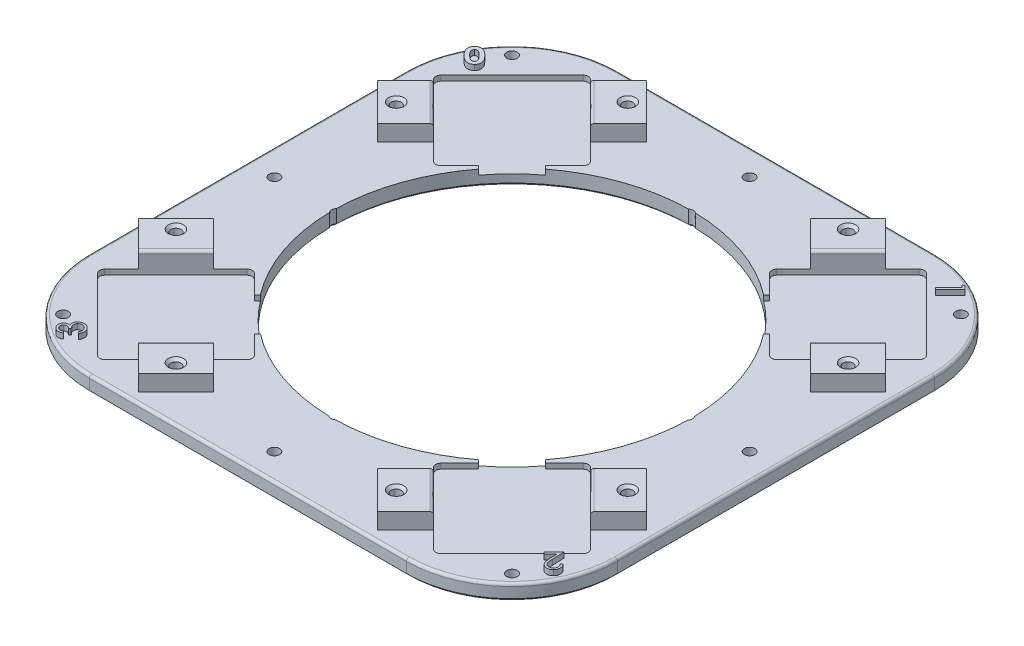
from build123d import *

# Parameters (mm, degrees)
SKETCH_1_W          = 200
SKETCH_1_H          = 200
SKETCH_1_R          = 2
EXTRUDE_1_DEPTH     = 6
CUT_EXTRUDE_1_DEPTH = 2
FILLET_1_R          = 2
EXTRUDE_3_DEPTH     = 6
FILLET_4_R          = 40
SKETCH_4_R          = 1.9
CUT_EXTRUDE_2_DEPTH = 8
SKETCH_7_R          = 12
SKETCH_7_W          = 40
SKETCH_7_H          = 12
SKETCH_7_W_2        = 12
SKETCH_7_H_2        = 40
CUT_EXTRUDE_3_DEPTH = 6
CUT_EXTRUDE_4_DEPTH = 2
FILLET_6_R          = 1
SKETCH_9_R          = 2
CUT_EXTRUDE_5_DEPTH = 10
EXTRUDE_6_DEPTH     = 2
FILLET_9_R          = 1
SKETCH_11_R         = 68
CUT_EXTRUDE_6_DEPTH = 10
CHAMFER_1_SIZE      = 1
CHAMFER_2_SIZE      = 1


with BuildPart() as part:
    # Эскиз1 → Бобышка-Вытянуть1 (new body)
    with BuildSketch(Plane(origin=(0, 0, 0), x_dir=(1, 0, 0), z_dir=(0, 1, 0))):
        Rectangle(SKETCH_1_W, SKETCH_1_H)
        with Locations((-90, 0)):
            Circle(SKETCH_1_R, mode=Mode.SUBTRACT)
        with Locations((0, 90)):
            Circle(SKETCH_1_R, mode=Mode.SUBTRACT)
        with Locations((90, 0)):
            Circle(SKETCH_1_R, mode=Mode.SUBTRACT)
        with Locations((0, -90)):
            Circle(SKETCH_1_R, mode=Mode.SUBTRACT)
        with Locations((-85, 85)):
            Circle(SKETCH_1_R, mode=Mode.SUBTRACT)
        with Locations((85, 85)):
            Circle(SKETCH_1_R, mode=Mode.SUBTRACT)
        with Locations((85, -85)):
            Circle(SKETCH_1_R, mode=Mode.SUBTRACT)
        with Locations((-85, -85)):
            Circle(SKETCH_1_R, mode=Mode.SUBTRACT)
    extrude(amount=EXTRUDE_1_DEPTH)

    # Эскиз2 → Вырез-Вытянуть1 (cut)
    with BuildSketch(Plane(origin=(0, 6, 0), x_dir=(1, 0, 0), z_dir=(0, 1, 0))):
        Polygon((63.639610307, 33.941125497), (33.941125497, 63.639610307), (63.639610307, 93.338095117), (93.338095117, 63.639610307), align=None)
        Polygon((33.941125497, -63.639610307), (63.639610307, -33.941125497), (93.338095117, -63.639610307), (63.639610307, -93.338095117), align=None)
        Polygon((-63.639610307, -33.941125497), (-33.941125497, -63.639610307), (-63.639610307, -93.338095117), (-93.338095117, -63.639610307), align=None)
        Polygon((-33.941125497, 63.639610307), (-63.639610307, 33.941125497), (-93.338095117, 63.639610307), (-63.639610307, 93.338095117), align=None)
    extrude(amount=-CUT_EXTRUDE_1_DEPTH, mode=Mode.SUBTRACT)

    # Скругление1
    fillet_1_edges = [part.edges().sort_by_distance(p)[0] for p in [
        (63.639610307, 5, -33.941125497),
        (33.941125497, 5, -63.639610307),
        (93.338095117, 5, -63.639610307),
        (63.639610307, 5, -93.338095117),
        (-63.639610307, 5, -93.338095117),
        (-63.639610307, 5, -33.941125497),
        (-93.338095117, 5, -63.639610307),
        (-33.941125497, 5, -63.639610307),
        (63.639610307, 5, 93.338095117),
        (93.338095117, 5, 63.639610307),
        (63.639610307, 5, 33.941125497),
        (33.941125497, 5, 63.639610307),
        (-63.639610307, 5, 93.338095117),
        (-33.941125497, 5, 63.639610307),
        (-63.639610307, 5, 33.941125497),
        (-93.338095117, 5, 63.639610307),
    ]]
    fillet(fillet_1_edges, radius=FILLET_1_R)

    # Эскиз3 → Бобышка-Вытянуть3 (add)
    with BuildSketch(Plane(origin=(0, 6, 0), x_dir=(1, 0, 0), z_dir=(0, 1, 0))):
        Polygon((41.71930009, 71.4177849), (55.861435714, 85.559920524), (45.254833996, 96.166522241), (31.112698372, 82.024386618), align=None)
        Polygon((85.559920524, 55.861435714), (96.166522241, 45.254833996), (82.024386618, 31.112698372), (71.4177849, 41.71930009), align=None)
        Polygon((71.4177849, -41.71930009), (85.559920524, -55.861435714), (96.166522241, -45.254833996), (82.024386618, -31.112698372), align=None)
        Polygon((31.112698372, -82.024386618), (45.254833996, -96.166522241), (55.861435714, -85.559920524), (41.71930009, -71.4177849), align=None)
        Polygon((-41.71930009, -71.4177849), (-55.861435714, -85.559920524), (-45.254833996, -96.166522241), (-31.112698372, -82.024386618), align=None)
        Polygon((-85.559920524, -55.861435714), (-96.166522241, -45.254833996), (-82.024386618, -31.112698372), (-71.4177849, -41.71930009), align=None)
        Polygon((-71.4177849, 41.71930009), (-85.559920524, 55.861435714), (-96.166522241, 45.254833996), (-82.024386618, 31.112698372), align=None)
        Polygon((-31.112698372, 82.024386618), (-45.254833996, 96.166522241), (-55.861435714, 85.559920524), (-41.71930009, 71.4177849), align=None)
    extrude(amount=EXTRUDE_3_DEPTH)

    # Скругление4
    fillet_4_edges = [part.edges().sort_by_distance(p)[0] for p in [
        (100, 3, -100),
        (100, 3, 100),
        (-100, 3, 100),
        (-100, 3, -100),
    ]]
    fillet(fillet_4_edges, radius=FILLET_4_R)

    # Эскиз4 → Вырез-Вытянуть2 (cut)
    with BuildSketch(Plane(origin=(0, 12, 0), x_dir=(1, 0, 0), z_dir=(0, 1, 0))):
        with Locations((41.71930009, 85.559920524)):
            Circle(SKETCH_4_R)
        with Locations((85.559920524, 41.71930009)):
            Circle(SKETCH_4_R)
        with Locations((85.559920524, -41.71930009)):
            Circle(SKETCH_4_R)
        with Locations((41.71930009, -85.559920524)):
            Circle(SKETCH_4_R)
        with Locations((-41.71930009, -85.559920524)):
            Circle(SKETCH_4_R)
        with Locations((-85.559920524, -41.71930009)):
            Circle(SKETCH_4_R)
        with Locations((-85.559920524, 41.71930009)):
            Circle(SKETCH_4_R)
        with Locations((-41.71930009, 85.559920524)):
            Circle(SKETCH_4_R)
    extrude(amount=-CUT_EXTRUDE_2_DEPTH, mode=Mode.SUBTRACT)

    # Эскиз7 → Вырез-Вытянуть3 (cut)
    with BuildSketch(Plane(origin=(0, 6, 0), x_dir=(1, 0, 0), z_dir=(0, 1, 0))):
        with Locations((28.284271247, 28.284271247)):
            Circle(SKETCH_7_R)
        with Locations((28.284271247, -28.284271247)):
            Circle(SKETCH_7_R)
        with Locations((-28.284271247, -28.284271247)):
            Circle(SKETCH_7_R)
        with Locations((-28.284271247, 28.284271247)):
            Circle(SKETCH_7_R)
        with Locations((40, 0)):
            Rectangle(SKETCH_7_W, SKETCH_7_H)
        with Locations((0, 40)):
            Rectangle(SKETCH_7_W_2, SKETCH_7_H_2)
        with Locations((0, -40)):
            Rectangle(SKETCH_7_W_2, SKETCH_7_H_2)
        with Locations((-40, 0)):
            Rectangle(SKETCH_7_W, SKETCH_7_H)
    extrude(amount=-CUT_EXTRUDE_3_DEPTH, mode=Mode.SUBTRACT)

    # Эскиз8 → Вырез-Вытянуть4 (cut)
    with BuildSketch(Plane(origin=(0, 6, 0), x_dir=(1, 0, 0), z_dir=(0, 1, 0))):
        Polygon((44.547727215, 31.819805153), (31.819805153, 44.547727215), (53.033008589, 65.76093065), (65.76093065, 53.033008589), align=None)
        Polygon((65.76093065, -53.033008589), (53.033008589, -65.76093065), (31.819805153, -44.547727215), (44.547727215, -31.819805153), align=None)
        Polygon((-44.547727215, -31.819805153), (-31.819805153, -44.547727215), (-53.033008589, -65.76093065), (-65.76093065, -53.033008589), align=None)
        Polygon((-65.76093065, 53.033008589), (-53.033008589, 65.76093065), (-31.819805153, 44.547727215), (-44.547727215, 31.819805153), align=None)
    extrude(amount=-CUT_EXTRUDE_4_DEPTH, mode=Mode.SUBTRACT)

    # Скругление6
    fillet_6_edges = [part.edges().sort_by_distance(p)[0] for p in [
        (78.488852712, 12, -48.790367902),
        (48.790367902, 12, -78.488852712),
        (-78.488852712, 12, 48.790367902),
        (-48.790367902, 12, 78.488852712),
        (48.790367902, 12, 78.488852712),
        (78.488852712, 12, 48.790367902),
        (-78.488852712, 12, -48.790367902),
        (-48.790367902, 12, -78.488852712),
    ]]
    fillet(fillet_6_edges, radius=FILLET_6_R)

    # Эскиз9 → Вырез-Вытянуть5 (cut)
    with BuildSketch(Plane(origin=(0, 6, 0), x_dir=(1, 0, 0), z_dir=(0, 1, 0))):
        with Locations((0.141931936, 66.467885895)):
            Circle(SKETCH_9_R)
        with Locations((-0.141931936, -66.467885895)):
            Circle(SKETCH_9_R)
        with Locations((66.467885895, -0.141931936)):
            Circle(SKETCH_9_R)
        with Locations((-66.467885895, 0.141931936)):
            Circle(SKETCH_9_R)
    extrude(amount=-CUT_EXTRUDE_5_DEPTH, mode=Mode.SUBTRACT)

    # Эскиз10 → Бобышка-Вытянуть6 (add)
    # profile 1 of 4: a face of its own
    with BuildSketch(Plane(origin=(0, 6, 0), x_dir=(1, 0, 0), z_dir=(0, 1, 0))):
        with BuildLine():
            add(Edge.make_bspline(
                [(-93.008725725, 78.748142248), (-92.957598681, 78.797521313), (-92.85676014, 78.894912293), (-92.695816741, 79.025623668), (-92.532835835, 79.143607747), (-92.364444707, 79.244705894), (-92.19338747, 79.333809788), (-92.016821516, 79.405990635), (-91.83577231, 79.461704551), (-91.651864556, 79.505826632), (-91.463065577, 79.533008597), (-91.270612251, 79.544105355), (-91.074440499, 79.539176393), (-90.875174478, 79.51794816), (-90.671949254, 79.481192006), (-90.46586329, 79.425437226), (-90.254902601, 79.357171516), (-90.040488058, 79.269212477), (-89.819864955, 79.163420892), (-89.593527751, 79.033863441), (-89.359570967, 78.882570897), (-89.117138773, 78.709656313), (-88.869800196, 78.51114685), (-88.612296924, 78.293135309), (-88.348308293, 78.050855484), (-88.172747767, 77.8784765), (-88.082443673, 77.789808915)],
                knots=[0, 0, 0, 0, 0.898182766, 1.771497688, 2.618542862, 3.439672004, 4.25211909, 5.054711465, 5.847125212, 6.644844624, 7.443249755, 8.254994895, 9.079117631, 9.921086753, 10.786032602, 11.686927653, 12.618018076, 13.587382576, 14.61431454, 15.709081657, 16.881705886, 18.135395254, 19.471648796, 20.88972771, 22.400151059, 24, 24, 24, 24], degree=3))
            add(Edge.make_bspline(
                [(-88.082443673, 77.789808915), (-87.99267599, 77.698463012), (-87.818629055, 77.521356129), (-87.574075163, 77.254376099), (-87.352755723, 76.995556331), (-87.155322982, 76.743444497), (-86.979453593, 76.499753648), (-86.827635494, 76.263265193), (-86.697172812, 76.035199404), (-86.593983854, 75.812528771), (-86.505762897, 75.597863606), (-86.435650692, 75.388405368), (-86.380204903, 75.184114783), (-86.341999183, 74.984749296), (-86.317124562, 74.790489333), (-86.308824987, 74.600690128), (-86.317259045, 74.415819605), (-86.339029871, 74.235495262), (-86.378224262, 74.059121756), (-86.433011633, 73.88543721), (-86.503667028, 73.713843244), (-86.590455303, 73.544917992), (-86.694786221, 73.379663841), (-86.810937292, 73.213769659), (-86.94605157, 73.051911723), (-87.045954632, 72.949414733), (-87.09686675, 72.89718071)],
                knots=[0, 0, 0, 0, 1.626693129, 3.153929617, 4.597923221, 5.951226613, 7.220381534, 8.41370076, 9.519612414, 10.554665343, 11.5286677, 12.466351198, 13.358440621, 14.215441504, 15.042756246, 15.844148676, 16.625203713, 17.391079629, 18.148401381, 18.916678168, 19.701702082, 20.502864672, 21.325687275, 22.182312009, 23.073678591, 24, 24, 24, 24], degree=3))
            add(Edge.make_bspline(
                [(-87.09686675, 72.89718071), (-87.149001816, 72.84614528), (-87.251598834, 72.745712247), (-87.415449357, 72.611920711), (-87.581095452, 72.493010238), (-87.748111845, 72.387124201), (-87.920307836, 72.299502255), (-88.094627597, 72.225293141), (-88.272021467, 72.16710318), (-88.452198674, 72.125173685), (-88.635693302, 72.099819479), (-88.822639538, 72.088904452), (-89.013082719, 72.090828854), (-89.207091086, 72.1143069), (-89.40536909, 72.145719544), (-89.606567507, 72.199199877), (-89.811492576, 72.264759097), (-90.022238393, 72.344954071), (-90.237893224, 72.447094582), (-90.460693886, 72.571345842), (-90.692551034, 72.717439447), (-90.930254984, 72.890031869), (-91.177219561, 73.084109407), (-91.432290045, 73.301626079), (-91.696875667, 73.541020342), (-91.871055441, 73.713771109), (-91.960648802, 73.802629428)],
                knots=[0, 0, 0, 0, 0.933090558, 1.836236452, 2.703091185, 3.541342316, 4.363641911, 5.172278286, 5.963363672, 6.749235136, 7.536057157, 8.330354457, 9.143829215, 9.968822976, 10.828425831, 11.710347207, 12.629007139, 13.581006501, 14.593064946, 15.679156618, 16.843448976, 18.097249152, 19.435871615, 20.861513249, 22.385647378, 24, 24, 24, 24], degree=3))
            add(Edge.make_bspline(
                [(-91.960648802, 73.802629428), (-92.083808079, 73.927961036), (-92.321358131, 74.169701086), (-92.642974702, 74.539928393), (-92.927306321, 74.894846854), (-93.16830981, 75.240335887), (-93.371354338, 75.572879883), (-93.528165963, 75.896472645), (-93.650478298, 76.206379417), (-93.697573804, 76.414092671), (-93.720264186, 76.514167889)],
                knots=[0, 0, 0, 0, 1.286987725, 2.482346486, 3.591022616, 4.616940247, 5.566609133, 6.441717498, 7.249227199, 8, 8, 8, 8], degree=3))
            add(Edge.make_bspline(
                [(-93.720264186, 76.514167889), (-93.73621609, 76.619695189), (-93.767435565, 76.826222703), (-93.769463604, 77.134773214), (-93.73708647, 77.432890992), (-93.662918531, 77.719164849), (-93.557667587, 77.996586653), (-93.410830123, 78.260518954), (-93.228823871, 78.514820834), (-93.083287813, 78.669100547), (-93.008725725, 78.748142248)],
                knots=[0, 0, 0, 0, 1.045976366, 2.04708071, 3.017702948, 3.979968869, 4.940634868, 5.921098241, 6.93492198, 8, 8, 8, 8], degree=3))
        make_face()
        with BuildLine():
            add(Edge.make_bspline(
                [(-91.968661622, 77.762565325), (-92.010462791, 77.716369621), (-92.09267178, 77.625518043), (-92.185599358, 77.466056849), (-92.247808891, 77.292789759), (-92.277000053, 77.138763868), (-92.281564988, 77.009210942), (-92.272569584, 76.906266824), (-92.255217222, 76.798367336), (-92.225720447, 76.685914195), (-92.185705795, 76.569081549), (-92.133366823, 76.447952044), (-92.070623007, 76.322116087), (-91.998518706, 76.18904091), (-91.910791112, 76.051145738), (-91.80930652, 75.904601817), (-91.691866402, 75.749325648), (-91.559047432, 75.584504399), (-91.409818285, 75.411433598), (-91.243944165, 75.230965793), (-91.065124091, 75.039589219), (-90.938036359, 74.911792703), (-90.872507776, 74.845898658)],
                knots=[0, 0, 0, 0, 1.075604722, 2.115356592, 3.167844591, 4.248203041, 4.812243559, 5.405508209, 6.032984943, 6.700942317, 7.414044194, 8.167617197, 8.981822607, 9.846245724, 10.784711884, 11.80756956, 12.929501316, 14.151980212, 15.469127066, 16.882155306, 18.392386567, 20, 20, 20, 20], degree=3))
            add(Edge.make_bspline(
                [(-90.872507776, 74.845898658), (-90.7864976, 74.761480543), (-90.621676348, 74.599710156), (-90.376186673, 74.375708535), (-90.142591105, 74.181411662), (-89.920993001, 74.01580443), (-89.712979922, 73.876185004), (-89.516195184, 73.766835437), (-89.332031918, 73.684611929), (-89.159202852, 73.630270157), (-88.995766399, 73.602382197), (-88.842298, 73.587529693), (-88.696426487, 73.594737092), (-88.558484062, 73.616713591), (-88.427977695, 73.656297414), (-88.306707853, 73.716054158), (-88.190628178, 73.788553381), (-88.124171611, 73.852114178), (-88.090456494, 73.884360197)],
                knots=[0, 0, 0, 0, 1.768629636, 3.389223978, 4.875842697, 6.225868878, 7.447880289, 8.54973518, 9.52566295, 10.403516369, 11.200100902, 11.95533547, 12.661618695, 13.336984531, 14.001570975, 14.653788248, 15.317032326, 16, 16, 16, 16], degree=3))
            add(Edge.make_bspline(
                [(-88.090456494, 73.884360197), (-88.060170206, 73.917273087), (-88.000655379, 73.981949384), (-87.928154313, 74.090301918), (-87.872339217, 74.205569408), (-87.835909962, 74.32905055), (-87.814669853, 74.458862384), (-87.812602281, 74.595619521), (-87.824773104, 74.739340345), (-87.846722465, 74.835951399), (-87.858084699, 74.885962761)],
                knots=[0, 0, 0, 0, 0.992959701, 1.951240279, 2.885912978, 3.828695135, 4.802734124, 5.800367936, 6.861345669, 8, 8, 8, 8], degree=3))
            add(Edge.make_bspline(
                [(-87.858084699, 74.885962761), (-87.877060945, 74.949998607), (-87.916921532, 75.084509222), (-88.007273396, 75.286598194), (-88.126064612, 75.49901867), (-88.272102307, 75.722527903), (-88.44647396, 75.957027887), (-88.648604001, 76.202021519), (-88.880645166, 76.45665197), (-89.04719527, 76.627386506), (-89.133725725, 76.716090966)],
                knots=[0, 0, 0, 0, 0.710523542, 1.492491535, 2.35044932, 3.300180637, 4.333113065, 5.460466168, 6.680595133, 8, 8, 8, 8], degree=3))
            add(Edge.make_bspline(
                [(-89.133725725, 76.716090966), (-89.222964963, 76.803682764), (-89.394241612, 76.971797487), (-89.648507303, 77.205255058), (-89.891423716, 77.406883944), (-90.117816027, 77.583359819), (-90.333231584, 77.728162558), (-90.534384646, 77.845045557), (-90.723026558, 77.930887678), (-90.898556487, 77.990917344), (-91.063656834, 78.023876163), (-91.218731192, 78.040982929), (-91.365199368, 78.039958248), (-91.503588791, 78.020388828), (-91.63445609, 77.984561165), (-91.755276867, 77.926461343), (-91.869565032, 77.855138121), (-91.935391485, 77.793645199), (-91.968661622, 77.762565325)],
                knots=[0, 0, 0, 0, 1.794997963, 3.44513516, 4.953227072, 6.325945798, 7.563759521, 8.676594079, 9.661550624, 10.534529874, 11.333105772, 12.073249666, 12.771110835, 13.429383314, 14.075074024, 14.709742177, 15.347875331, 16, 16, 16, 16], degree=3))
        make_face(mode=Mode.SUBTRACT)
    # profile 2 of 4: a face of its own
    with BuildSketch(Plane(origin=(0, 6, 0), x_dir=(1, 0, 0), z_dir=(0, 1, 0))):
        Polygon((78.440095754, 93.074368887), (79.541057292, 91.973407348), (73.941698318, 86.374048374), (73.385608575, 86.930138118), (78.436890626, 91.981420169), (77.557082933, 92.861227861), align=None)
    # profile 3 of 4: a face of its own
    with BuildSketch(Plane(origin=(0, 6, 0), x_dir=(1, 0, 0), z_dir=(0, 1, 0))):
        with BuildLine():
            Line((92.978731613, -74.683298044), (93.515590587, -74.14643907))
            add(Edge.make_bspline(
                [(93.515590587, -74.14643907), (93.57979168, -74.217561095), (93.705938599, -74.357306758), (93.872192198, -74.580565611), (94.0096643, -74.812483922), (94.124946647, -75.049578001), (94.215404454, -75.292959176), (94.277694742, -75.544127868), (94.316788413, -75.801118589), (94.328555137, -76.062538369), (94.318422495, -76.32287574), (94.281216893, -76.576781617), (94.220051936, -76.822145442), (94.134830229, -77.05845039), (94.025582223, -77.28616355), (93.889081572, -77.503018406), (93.730477042, -77.712924928), (93.608225903, -77.841999489), (93.546039305, -77.907657019)],
                knots=[0, 0, 0, 0, 1.097080493, 2.155622548, 3.181877021, 4.180734131, 5.171877943, 6.149826956, 7.139761318, 8.144411119, 9.14266836, 10.119602376, 11.078258423, 12.0343727, 12.992188754, 13.965052194, 14.964864601, 16, 16, 16, 16], degree=3))
            add(Edge.make_bspline(
                [(93.546039305, -77.907657019), (93.482090698, -77.969428879), (93.356687631, -78.090563349), (93.151429875, -78.244882669), (92.942680032, -78.37895674), (92.725313898, -78.484156569), (92.502307063, -78.567304392), (92.272879379, -78.625036467), (92.036408861, -78.657581549), (91.796858495, -78.662803423), (91.558717577, -78.647071576), (91.328114136, -78.610221179), (91.106309941, -78.554059657), (90.894170445, -78.476955727), (90.69100415, -78.378911034), (90.498450265, -78.258608397), (90.312382857, -78.122050971), (90.200365868, -78.014736799), (90.143795716, -77.960541634)],
                knots=[0, 0, 0, 0, 1.122093018, 2.200421744, 3.237554738, 4.251534574, 5.244276876, 6.239309773, 7.233678941, 8.25294369, 9.26061734, 10.244606756, 11.198736813, 12.14649875, 13.09110873, 14.042419092, 15.011394142, 16, 16, 16, 16], degree=3))
            add(Edge.make_bspline(
                [(90.143795716, -77.960541634), (90.06838982, -77.879576092), (89.91877248, -77.718927525), (89.733967572, -77.445845524), (89.584072127, -77.153182093), (89.489411425, -76.889885212), (89.430647816, -76.660895349), (89.391527922, -76.464896649), (89.354319473, -76.246967695), (89.323162154, -76.005743563), (89.29417061, -75.742397125), (89.270319478, -75.45596892), (89.251579707, -75.147093558), (89.241802351, -74.933312205), (89.236744434, -74.822721121)],
                knots=[0, 0, 0, 0, 1.186803905, 2.354808508, 3.527369274, 4.71059022, 5.350674727, 6.065137202, 6.856453041, 7.724624025, 8.676850923, 9.701662735, 10.811048734, 12, 12, 12, 12], degree=3))
            Line((89.236744434, -74.822721121), (89.12616751, -71.926887788))
            Line((89.12616751, -71.926887788), (86.541231613, -74.511823685))
            Line((86.541231613, -74.511823685), (86.00116751, -73.971759583))
            Line((86.00116751, -73.971759583), (89.804052126, -70.168874967))
            Line((89.804052126, -70.168874967), (89.975526485, -74.61919548))
            add(Edge.make_bspline(
                [(89.975526485, -74.61919548), (89.97940604, -74.72712057), (89.986860215, -74.934487794), (90.003890674, -75.233029494), (90.019624168, -75.50625937), (90.043566004, -75.75394261), (90.06564968, -75.976592217), (90.095425878, -76.173535946), (90.124676221, -76.345461481), (90.168824981, -76.538523396), (90.23936523, -76.755529595), (90.356972999, -76.992365375), (90.498540406, -77.21240251), (90.616674642, -77.339291696), (90.675846998, -77.402849326)],
                knots=[0, 0, 0, 0, 1.320717269, 2.537625612, 3.657091802, 4.667335419, 5.580706193, 6.392834347, 7.10280944, 7.712944814, 8.814093938, 9.883466006, 10.93984752, 12, 12, 12, 12], degree=3))
            add(Edge.make_bspline(
                [(90.675846998, -77.402849326), (90.715762518, -77.440491138), (90.794563147, -77.514803044), (90.923578393, -77.611670036), (91.059857654, -77.691744666), (91.203081359, -77.756245876), (91.352325662, -77.808417727), (91.509417042, -77.84322442), (91.673171622, -77.86207557), (91.841072337, -77.867216475), (92.009961942, -77.855516387), (92.175462222, -77.830692716), (92.335424905, -77.788442162), (92.488974446, -77.730963732), (92.63686883, -77.65745526), (92.779385889, -77.569475576), (92.916642426, -77.465111951), (93.000335801, -77.384492124), (93.042834177, -77.343554455)],
                knots=[0, 0, 0, 0, 0.999414226, 1.973028734, 2.933162718, 3.874301026, 4.831864631, 5.809753659, 6.800020608, 7.832465231, 8.866744497, 9.881594604, 10.878159325, 11.876387246, 12.86478581, 13.883411814, 14.925224832, 16, 16, 16, 16], degree=3))
            add(Edge.make_bspline(
                [(93.042834177, -77.343554455), (93.085971983, -77.29897834), (93.170746275, -77.211377487), (93.280021317, -77.067662313), (93.371539202, -76.917986932), (93.447322526, -76.763501475), (93.507260364, -76.604334053), (93.549404033, -76.439373624), (93.572814515, -76.2684341), (93.581008072, -76.093006632), (93.571727119, -75.914621837), (93.542273015, -75.73648388), (93.495192881, -75.558323393), (93.430044659, -75.380806329), (93.34279892, -75.20509369), (93.240953397, -75.028485632), (93.118160612, -74.853500614), (93.025950971, -74.740939253), (92.978731613, -74.683298044)],
                knots=[0, 0, 0, 0, 1.00435318, 1.973751999, 2.917821866, 3.842935876, 4.757667598, 5.668706735, 6.595277109, 7.548310303, 8.510417973, 9.48367281, 10.468252952, 11.4923997, 12.541405892, 13.642871744, 14.792945286, 16, 16, 16, 16], degree=3))
        make_face()
    # profile 4 of 4: a face of its own
    with BuildSketch(Plane(origin=(0, 6, 0), x_dir=(1, 0, 0), z_dir=(0, 1, 0))):
        with BuildLine():
            Line((-77.388715553, -92.454657468), (-76.802177092, -93.02196516))
            add(Edge.make_bspline(
                [(-76.802177092, -93.02196516), (-76.872074017, -93.066285105), (-77.009193948, -93.153229528), (-77.221245979, -93.263222601), (-77.431874401, -93.355769168), (-77.64204283, -93.427893024), (-77.851510765, -93.48173737), (-78.060252855, -93.514710119), (-78.26822027, -93.532269537), (-78.474255518, -93.526358935), (-78.676988968, -93.504358079), (-78.873717005, -93.464118869), (-79.064802464, -93.407793132), (-79.248731568, -93.334076039), (-79.426690369, -93.243281798), (-79.598271698, -93.136210179), (-79.762535153, -93.010024629), (-79.865353835, -92.915908177), (-79.917561707, -92.868119006)],
                knots=[0, 0, 0, 0, 1.169279398, 2.293827799, 3.37245145, 4.41823223, 5.430864929, 6.42509182, 7.401967133, 8.376183799, 9.33334128, 10.280982312, 11.210249107, 12.145386172, 13.077317515, 14.030476502, 14.999942152, 16, 16, 16, 16], degree=3))
            add(Edge.make_bspline(
                [(-79.917561707, -92.868119006), (-79.988920031, -92.793915351), (-80.13012374, -92.647081306), (-80.306994952, -92.399433841), (-80.450747659, -92.133673041), (-80.562173881, -91.854130293), (-80.638288532, -91.566288195), (-80.673674749, -91.278376936), (-80.670891848, -90.993695007), (-80.628901464, -90.716257597), (-80.552855322, -90.450259759), (-80.442808141, -90.204893605), (-80.306804124, -89.977972028), (-80.190611, -89.848268388), (-80.132305297, -89.783183109)],
                knots=[0, 0, 0, 0, 1.079631469, 2.136372602, 3.182766178, 4.244954198, 5.288217467, 6.299582755, 7.281027378, 8.267633372, 9.236679149, 10.175611233, 11.084521819, 12, 12, 12, 12], degree=3))
            add(Edge.make_bspline(
                [(-80.132305297, -89.783183109), (-80.071332651, -89.724753249), (-79.951762443, -89.610169563), (-79.748381213, -89.471190926), (-79.532010491, -89.364348043), (-79.301508127, -89.289802953), (-79.057050132, -89.248329314), (-78.799158916, -89.239790928), (-78.527911531, -89.261925886), (-78.346160961, -89.301335363), (-78.252497604, -89.321644647)],
                knots=[0, 0, 0, 0, 0.994959293, 1.951161675, 2.892524362, 3.833211752, 4.798837926, 5.80788833, 6.870316961, 8, 8, 8, 8], degree=3))
            add(Edge.make_bspline(
                [(-78.252497604, -89.321644647), (-78.2908941, -89.227417901), (-78.366455678, -89.04198635), (-78.433533784, -88.752543136), (-78.468825619, -88.462397129), (-78.460297874, -88.26936548), (-78.456023245, -88.172606186)],
                knots=[0, 0, 0, 0, 1.034463078, 2.035749934, 3.015397462, 4, 4, 4, 4], degree=3))
            add(Edge.make_bspline(
                [(-78.456023245, -88.172606186), (-78.449288881, -88.105111251), (-78.436049064, -87.972415657), (-78.394386167, -87.778644977), (-78.340246105, -87.592612574), (-78.271950602, -87.41388508), (-78.185386109, -87.244752842), (-78.086329088, -87.082127181), (-77.970712952, -86.92772678), (-77.883148966, -86.832672184), (-77.839036066, -86.784785673)],
                knots=[0, 0, 0, 0, 1.04938919, 2.063107758, 3.062796941, 4.047250166, 5.019961658, 6.00006311, 6.992473739, 8, 8, 8, 8], degree=3))
            add(Edge.make_bspline(
                [(-77.839036066, -86.784785673), (-77.757764137, -86.707011683), (-77.595555492, -86.551784486), (-77.314339011, -86.362283402), (-77.00690324, -86.211377214), (-76.678775657, -86.096957633), (-76.337780488, -86.021689696), (-75.992384551, -85.998456457), (-75.648247161, -86.020429174), (-75.30852581, -86.092358394), (-74.975836653, -86.206866008), (-74.658919531, -86.369981879), (-74.355276993, -86.571977286), (-74.173558247, -86.737405252), (-74.081023245, -86.821644647)],
                knots=[0, 0, 0, 0, 0.966121529, 1.928258222, 2.902202989, 3.904812497, 4.910491246, 5.896124049, 6.872277065, 7.867065951, 8.874013802, 9.889062967, 10.92506653, 12, 12, 12, 12], degree=3))
            add(Edge.make_bspline(
                [(-74.081023245, -86.821644647), (-74.021853204, -86.881667927), (-73.905378738, -86.999821968), (-73.750010399, -87.188779842), (-73.616060265, -87.384318945), (-73.501384782, -87.584883398), (-73.407951202, -87.792558543), (-73.335758423, -88.006211938), (-73.283928402, -88.225649401), (-73.254012973, -88.449994375), (-73.243405037, -88.678597891), (-73.258616666, -88.909429614), (-73.295934925, -89.142204022), (-73.356030565, -89.376896446), (-73.437638527, -89.614740521), (-73.544783279, -89.853551775), (-73.672760277, -90.094886692), (-73.773237898, -90.251289766), (-73.824612989, -90.331260032)],
                knots=[0, 0, 0, 0, 1.045386523, 2.057812277, 3.030335339, 3.9831449, 4.920592867, 5.851197628, 6.777212156, 7.713628621, 8.655634425, 9.611918591, 10.578438017, 11.576706329, 12.614247281, 13.694355822, 14.821103873, 16, 16, 16, 16], degree=3))
            Line((-73.824612989, -90.331260032), (-74.387112989, -89.786388237))
            add(Edge.make_bspline(
                [(-74.387112989, -89.786388237), (-74.356108499, -89.729521047), (-74.295703021, -89.618727748), (-74.216755615, -89.452142222), (-74.152845056, -89.290175233), (-74.101233485, -89.134547193), (-74.061745375, -88.985413058), (-74.03787435, -88.841628771), (-74.0254386, -88.703252914), (-74.028325632, -88.612793387), (-74.029741194, -88.568439519)],
                knots=[0, 0, 0, 0, 1.208474665, 2.354448952, 3.437297787, 4.455450756, 5.412846772, 6.31251137, 7.172595194, 8, 8, 8, 8], degree=3))
            add(Edge.make_bspline(
                [(-74.029741194, -88.568439519), (-74.034859604, -88.513754216), (-74.045091811, -88.404432883), (-74.083607887, -88.244282225), (-74.135192606, -88.087829609), (-74.200435306, -87.934539232), (-74.284661095, -87.786835222), (-74.385183264, -87.644176856), (-74.498874455, -87.503469008), (-74.585051384, -87.416022074), (-74.629100169, -87.371324134)],
                knots=[0, 0, 0, 0, 0.961215761, 1.921565418, 2.877526972, 3.845915068, 4.834977089, 5.850130758, 6.901108131, 8, 8, 8, 8], degree=3))
            add(Edge.make_bspline(
                [(-74.629100169, -87.371324134), (-74.681090431, -87.322723333), (-74.782445027, -87.227976466), (-74.946347893, -87.106489871), (-75.110690459, -87.000747278), (-75.281027643, -86.917143209), (-75.454113249, -86.850977835), (-75.631241254, -86.803553156), (-75.812608999, -86.778698861), (-75.995053098, -86.770559067), (-76.175866677, -86.78030301), (-76.350156794, -86.805831688), (-76.517207594, -86.845992364), (-76.675973132, -86.901663669), (-76.826644699, -86.974919386), (-76.969041379, -87.0634642), (-77.105388267, -87.165921189), (-77.187099009, -87.245903166), (-77.228459143, -87.286388237)],
                knots=[0, 0, 0, 0, 1.175407728, 2.291447812, 3.366826222, 4.401376563, 5.421356114, 6.425777831, 7.424712672, 8.441055237, 9.440185163, 10.412905177, 11.348740396, 12.27587154, 13.188083527, 14.111845111, 15.044258618, 16, 16, 16, 16], degree=3))
            add(Edge.make_bspline(
                [(-77.228459143, -87.286388237), (-77.279535789, -87.343676672), (-77.381130905, -87.457627482), (-77.499712365, -87.655724529), (-77.592090729, -87.869391226), (-77.651660421, -88.098638567), (-77.68282183, -88.334507466), (-77.679719441, -88.572073434), (-77.641973735, -88.806620658), (-77.583578611, -88.999765985), (-77.514478245, -89.154475969), (-77.450854739, -89.280094261), (-77.369835179, -89.411062603), (-77.274409568, -89.548591317), (-77.16717371, -89.695487967), (-77.043439646, -89.847826927), (-76.907482639, -90.009367385), (-76.808529826, -90.115870536), (-76.757305297, -90.171003621)],
                knots=[0, 0, 0, 0, 1.121186236, 2.230119901, 3.361455773, 4.518304567, 5.684940395, 6.834367639, 7.982224936, 9.152000404, 9.775180233, 10.460538472, 11.21144107, 12.026855747, 12.910381899, 13.872566936, 14.898699748, 16, 16, 16, 16], degree=3))
            Line((-76.757305297, -90.171003621), (-77.268523245, -90.698247211))
            add(Edge.make_bspline(
                [(-77.268523245, -90.698247211), (-77.334741975, -90.637662351), (-77.464455594, -90.518984727), (-77.674721718, -90.365511058), (-77.893339725, -90.238268001), (-78.117019946, -90.138197165), (-78.337856669, -90.066171049), (-78.549142261, -90.022294312), (-78.748678618, -90.01180744), (-78.935354408, -90.032599171), (-79.107876819, -90.081434292), (-79.26675635, -90.152405628), (-79.412233777, -90.246112213), (-79.495636262, -90.325050512), (-79.537754015, -90.364913878)],
                knots=[0, 0, 0, 0, 1.265456482, 2.478859708, 3.664135126, 4.827966215, 5.929008543, 6.935492065, 7.863532652, 8.735702181, 9.573157525, 10.382716827, 11.183281726, 12, 12, 12, 12], degree=3))
            add(Edge.make_bspline(
                [(-79.537754015, -90.364913878), (-79.566835094, -90.396326023), (-79.624336337, -90.458436421), (-79.696526522, -90.562084864), (-79.756029374, -90.671258332), (-79.803081897, -90.78690076), (-79.837938732, -90.907750185), (-79.860995191, -91.034995575), (-79.869606859, -91.167658934), (-79.868291906, -91.304874511), (-79.854677693, -91.443051203), (-79.824958806, -91.578642797), (-79.783618958, -91.710304709), (-79.728268952, -91.83776375), (-79.660897843, -91.962176959), (-79.578201221, -92.082039768), (-79.484225877, -92.199700167), (-79.412386344, -92.272065664), (-79.37589504, -92.308824134)],
                knots=[0, 0, 0, 0, 0.945622928, 1.869755011, 2.784173497, 3.690084153, 4.624650255, 5.560708084, 6.543661072, 7.559560387, 8.592687063, 9.607418322, 10.623523625, 11.63942294, 12.675449106, 13.746764168, 14.855455909, 16, 16, 16, 16], degree=3))
            add(Edge.make_bspline(
                [(-79.37589504, -92.308824134), (-79.31341616, -92.364332751), (-79.191190113, -92.472923025), (-78.983632536, -92.597570118), (-78.763503707, -92.682251946), (-78.570315062, -92.721099458), (-78.409608163, -92.72848978), (-78.281445256, -92.725873293), (-78.147312061, -92.709585749), (-78.00752194, -92.679373618), (-77.861262426, -92.641186153), (-77.708597774, -92.591302884), (-77.550032642, -92.528408132), (-77.443524486, -92.47971492), (-77.388715553, -92.454657468)],
                knots=[0, 0, 0, 0, 1.401169659, 2.741077084, 4.038764372, 5.345842331, 6.028511183, 6.737373733, 7.496180119, 8.293104039, 9.137291959, 10.033670791, 10.988130031, 12, 12, 12, 12], degree=3))
        make_face()
    extrude(amount=EXTRUDE_6_DEPTH)

    # Скругление9
    fillet_9_edges = [part.edges().sort_by_distance(p)[0] for p in [
        (88.284271247, 6, 88.284271247),
        (0, 6, 100),
        (-88.284271247, 6, 88.284271247),
        (-100, 6, 0),
        (-88.284271247, 6, -88.284271247),
        (0, 6, -100),
        (88.284271247, 6, -88.284271247),
        (100, 6, 0),
    ]]
    fillet(fillet_9_edges, radius=FILLET_9_R)

    # Эскиз11 → Вырез-Вытянуть6 (cut)
    with BuildSketch(Plane(origin=(0, 6, 0), x_dir=(1, 0, 0), z_dir=(0, 1, 0))):
        Circle(SKETCH_11_R)
    extrude(amount=-CUT_EXTRUDE_6_DEPTH, mode=Mode.SUBTRACT)

    # Фаска1
    chamfer_1_edges = [part.edges().sort_by_distance(p)[0] for p in [
        (100, 0, 0),
        (88.284271247, 0, -88.284271247),
        (88.284271247, 0, 88.284271247),
        (0, 0, -100),
        (0, 0, 100),
        (-88.284271247, 0, -88.284271247),
        (-88.284271247, 0, 88.284271247),
        (-100, 0, 0),
        (-87, 0, 85),
        (83, 0, -85),
        (-92, 0, 0),
        (88, 0, 0),
        (-2, 0, -90),
        (-2, 0, 90),
        (-87, 0, -85),
        (83, 0, 85),
        (-68.467881335, 0, -0.146202619),
        (68.467881335, 0, 0.146202619),
        (-0.146202619, 0, 68.467881335),
        (0.146202619, 0, -68.467881335),
        (47.980477332, 0, 48.185825665),
        (-48.185825665, 0, 47.980477332),
        (-47.980477332, 0, -48.185825665),
        (48.185825665, 0, -47.980477332),
    ]]
    chamfer(chamfer_1_edges, length=CHAMFER_1_SIZE)

    # Фаска2
    chamfer_2_edges = [part.edges().sort_by_distance(p)[0] for p in [
        (-87.459920524, 12, 41.71930009),
        (-43.61930009, 12, 85.559920524),
        (39.81930009, 12, 85.559920524),
        (83.659920524, 12, 41.71930009),
        (83.659920524, 12, -41.71930009),
        (39.81930009, 12, -85.559920524),
        (-87.459920524, 12, -41.71930009),
        (-43.61930009, 12, -85.559920524),
    ]]
    chamfer(chamfer_2_edges, length=CHAMFER_2_SIZE)


solid = part.part
